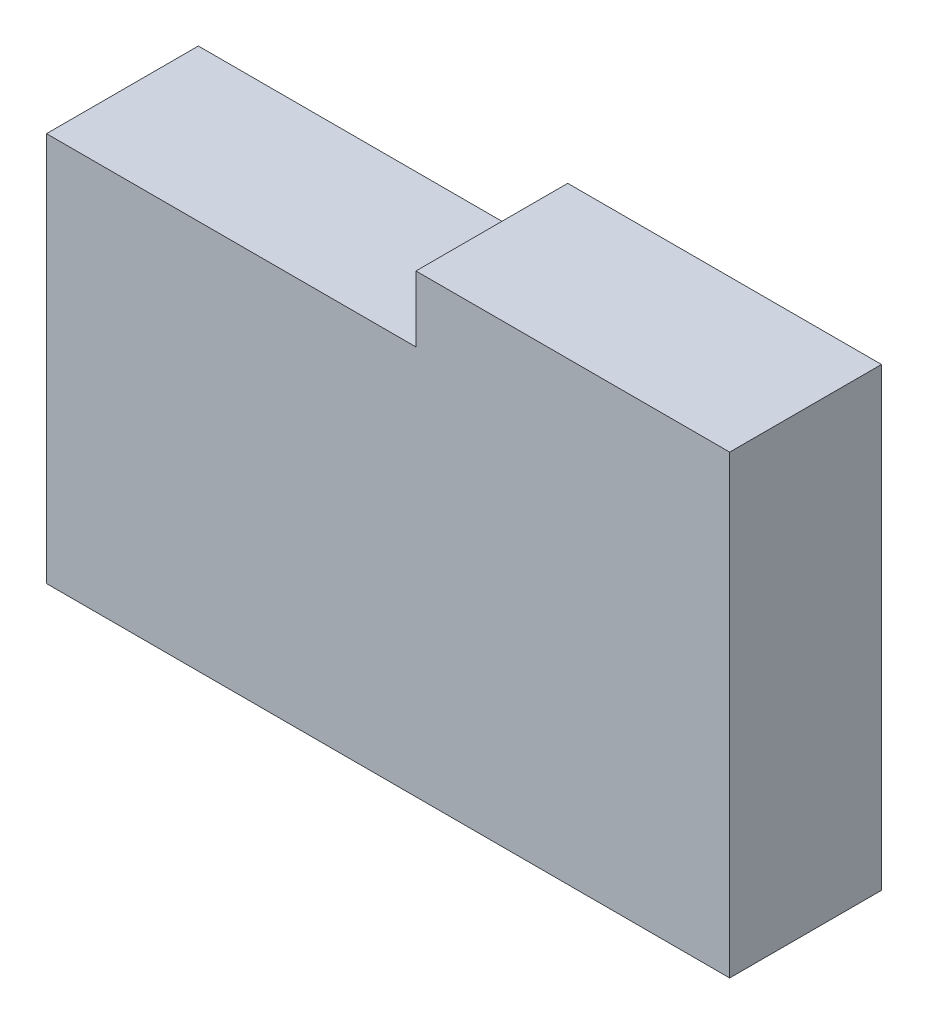
from build123d import *

# Parameters (mm, degrees)
BOSS_EXTRU_1_DEPTH = 30


with BuildPart() as part:
    # Esquisse1 → Boss.-Extru.1 (new body)
    with BuildSketch(Plane.XY):
        Polygon((0, 0), (135, 0), (135, 90), (73, 90), (73, 77), (0, 77), align=None)
    extrude(amount=-BOSS_EXTRU_1_DEPTH)


solid = part.part
